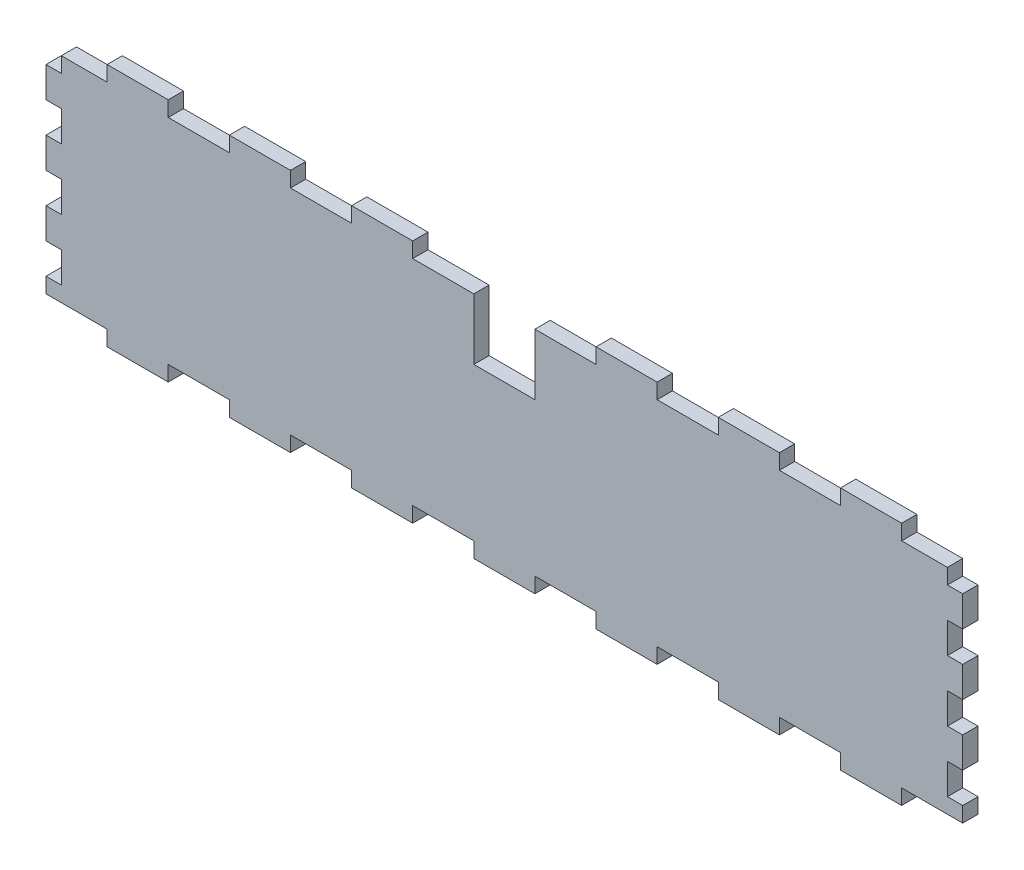
from build123d import *

# Parameters (mm, degrees)
SKETCH1_W           = 381
SKETCH1_H           = 101.6
BOSS_EXTRUDE1_DEPTH = 6.35
SKETCH2_W           = 25.4
SKETCH2_H           = 6.35
SKETCH2_W_2         = 6.35
SKETCH2_H_2         = 12.7
CUT_EXTRUDE1_DEPTH  = 6.35
SKETCH3_W           = 25.4
SKETCH3_H           = 31.75
CUT_EXTRUDE2_DEPTH  = 6.35


with BuildPart() as part:
    # Sketch1 → Boss-Extrude1 (new body)
    with BuildSketch(Plane.XY):
        Rectangle(SKETCH1_W, SKETCH1_H)
    extrude(amount=BOSS_EXTRUDE1_DEPTH)

    # Sketch2 → Cut-Extrude1 (cut)
    with BuildSketch(Plane.XY.offset(6.35)):
        with Locations((-127, 47.625)):
            Rectangle(SKETCH2_W, SKETCH2_H)
        Polygon((-165.1, 44.45), (-165.1, 50.8), (-190.5, 50.8), (-190.5, 38.1), (-184.15, 38.1), (-184.15, 44.45), align=None)
        with Locations((-76.2, 47.625)):
            Rectangle(SKETCH2_W, SKETCH2_H)
        with Locations((-25.4, 47.625)):
            Rectangle(SKETCH2_W, SKETCH2_H)
        with Locations((25.4, 47.625)):
            Rectangle(SKETCH2_W, SKETCH2_H)
        with Locations((-187.325, 19.05)):
            Rectangle(SKETCH2_W_2, SKETCH2_H_2)
        with Locations((76.2, 47.625)):
            Rectangle(SKETCH2_W, SKETCH2_H)
        with Locations((-187.325, -6.35)):
            Rectangle(SKETCH2_W_2, SKETCH2_H_2)
        with Locations((127, 47.625)):
            Rectangle(SKETCH2_W, SKETCH2_H)
        with Locations((-187.325, -31.75)):
            Rectangle(SKETCH2_W_2, SKETCH2_H_2)
        Polygon((165.1, 50.8), (165.1, 44.45), (184.15, 44.45), (184.15, 38.1), (190.5, 38.1), (190.5, 50.8), align=None)
        with Locations((-177.8, -47.625)):
            Rectangle(SKETCH2_W, SKETCH2_H)
        with Locations((-127, -47.625)):
            Rectangle(SKETCH2_W, SKETCH2_H)
        with Locations((187.325, 19.05)):
            Rectangle(SKETCH2_W_2, SKETCH2_H_2)
        with Locations((-76.2, -47.625)):
            Rectangle(SKETCH2_W, SKETCH2_H)
        with Locations((187.325, -6.35)):
            Rectangle(SKETCH2_W_2, SKETCH2_H_2)
        with Locations((-25.4, -47.625)):
            Rectangle(SKETCH2_W, SKETCH2_H)
        with Locations((187.325, -31.75)):
            Rectangle(SKETCH2_W_2, SKETCH2_H_2)
        with Locations((25.4, -47.625)):
            Rectangle(SKETCH2_W, SKETCH2_H)
        with Locations((177.8, -47.625)):
            Rectangle(SKETCH2_W, SKETCH2_H)
        with Locations((76.2, -47.625)):
            Rectangle(SKETCH2_W, SKETCH2_H)
        with Locations((127, -47.625)):
            Rectangle(SKETCH2_W, SKETCH2_H)
    extrude(amount=-CUT_EXTRUDE1_DEPTH, mode=Mode.SUBTRACT)

    # Sketch3 → Cut-Extrude2 (cut)
    with BuildSketch(Plane.XY.offset(6.35)):
        with Locations((0, 34.925)):
            Rectangle(SKETCH3_W, SKETCH3_H)
    extrude(amount=-CUT_EXTRUDE2_DEPTH, mode=Mode.SUBTRACT)


solid = part.part
